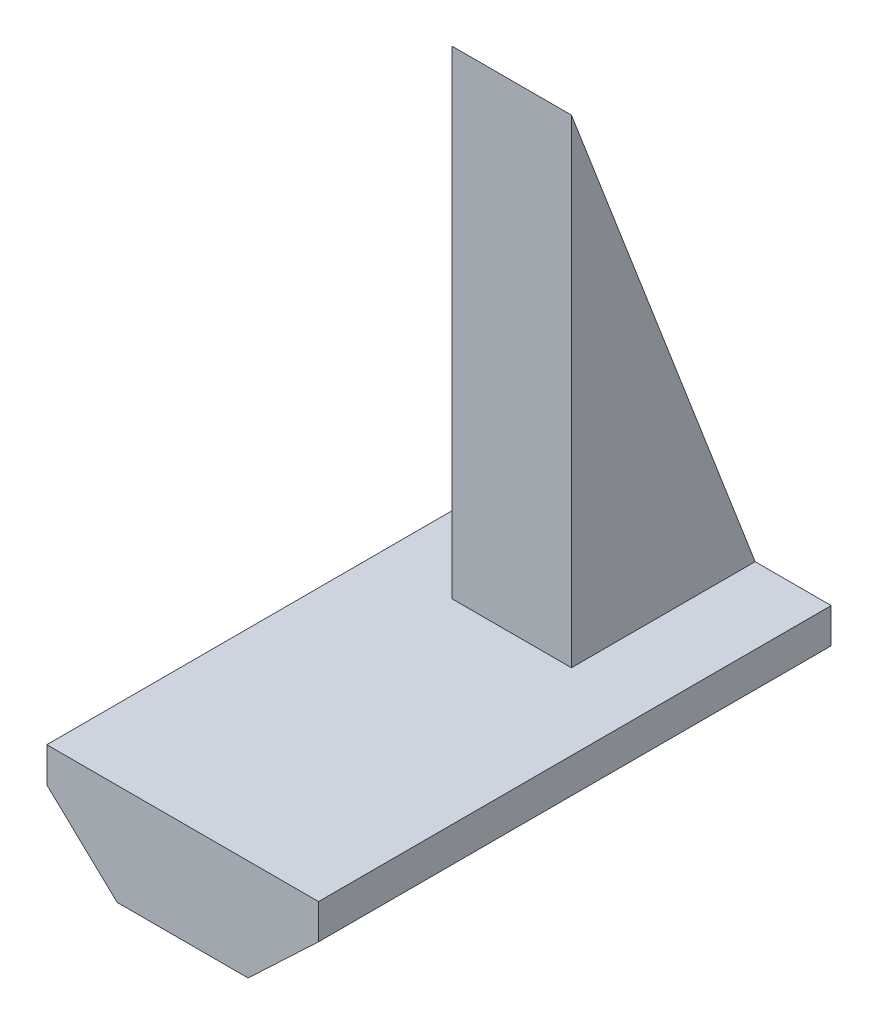
from build123d import *

# Parameters (mm, degrees)
BOSS_EXTRUDE1_DEPTH = 30
BOSS_EXTRUDE2_DEPTH = 3.5


with BuildPart() as part:
    # Sketch1 → Boss-Extrude1 (new body)
    with BuildSketch(Plane.XY):
        Polygon((7.95, 0), (7.95, -2.04), (3.828346154, -5.933696133), (-3.828346154, -5.933696133), (-7.95, -2.04), (-7.95, 0), align=None)
    extrude(amount=BOSS_EXTRUDE1_DEPTH)

    # Sketch2 → Boss-Extrude2 (add, symmetric)
    with BuildSketch(Plane.ZY):
        Polygon((0, 0), (10.751038486, 28.007412795), (10.751038486, 0), align=None)
    extrude(amount=BOSS_EXTRUDE2_DEPTH, both=True)


solid = part.part
